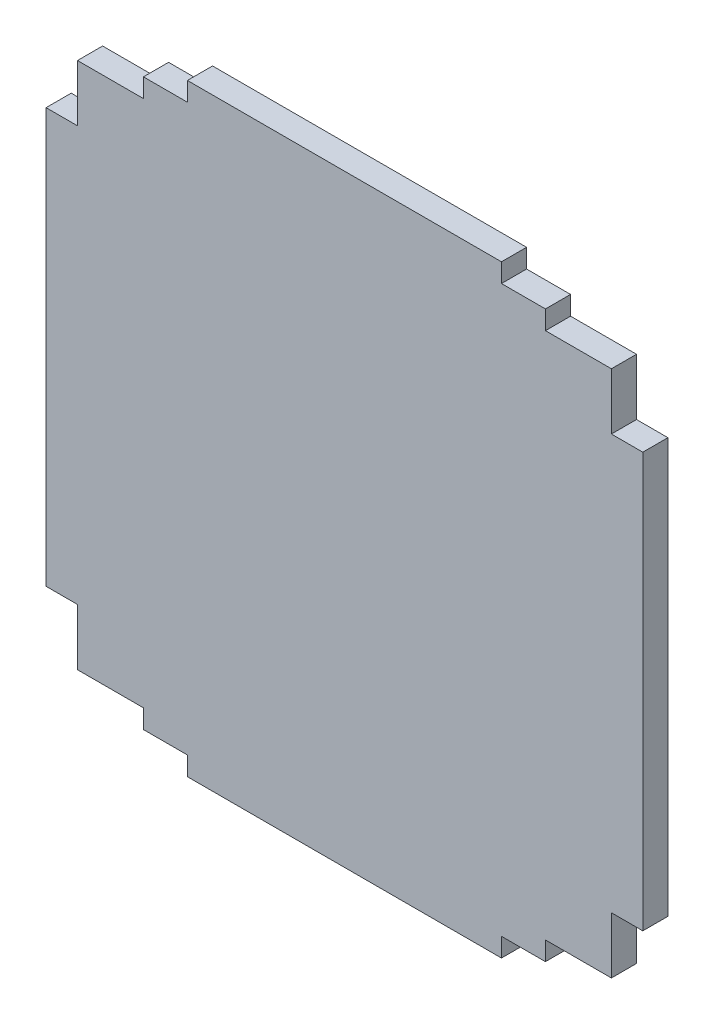
from build123d import *

# Parameters (mm, degrees)
BOSS_EXTRUDE1_DEPTH = 4


with BuildPart() as part:
    # Sketch1 → Boss-Extrude1 (new body)
    with BuildSketch(Plane.XY):
        Polygon((-47.81401419, 32.999996484), (-42.81401419, 32.999996674), (-42.814014531, 41.999996674), (-32.314014531, 41.999997072), (-32.314014645, 44.999997072), (-25.314014645, 44.999997337), (-25.314014759, 47.999997337), (24.685985241, 47.999999233), (24.685985355, 44.999999233), (31.685985355, 44.999999498), (31.685985469, 41.999999498), (42.185985469, 41.999999896), (42.18598581, 32.999999896), (47.18598581, 33.000000086), (47.185988312, -32.999999914), (42.18598581, -32.999999896), (42.185985469, -41.999999896), (31.685985469, -41.999999498), (31.685985355, -44.999999498), (24.685985355, -44.999999233), (24.685985241, -47.999999233), (-25.314014759, -47.999997337), (-25.314014645, -44.999997337), (-32.314014645, -44.999997072), (-32.314014531, -41.999997072), (-42.814014531, -41.999996674), (-42.81401419, -32.999996674), (-47.81401419, -32.999996484), align=None)
    extrude(amount=BOSS_EXTRUDE1_DEPTH)


solid = part.part
